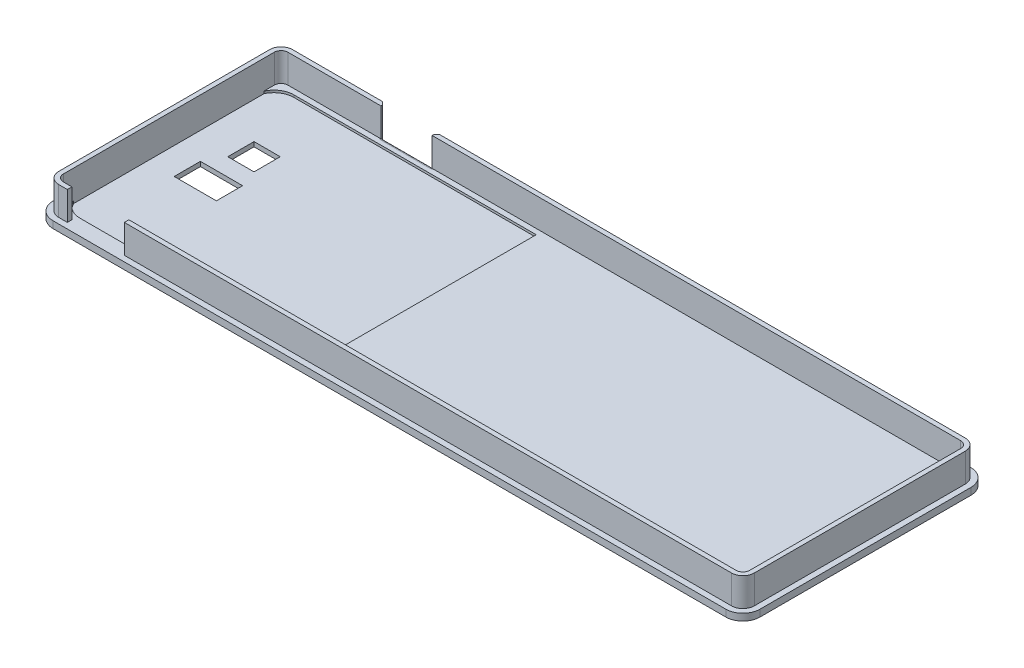
from build123d import *

# Parameters (mm, degrees)
SKETCH_1_W               = 124
SKETCH_1_H               = 43
EXTRUDE_1_DEPTH          = 1.2
CUT_EXTRUDE_1_REACH      = 110.402
SKETCH_3_W               = 7.4
SKETCH_3_H               = 4.6
SKETCH_3_W_2             = 4.6
CUT_EXTRUDE_2_DEPTH      = 0.4
FILLET_1_R               = 3
EXTRUDE_START            = 5
EXTRUDE_5_DEPTH          = 5
SKETCH_7_W               = 0.8
SKETCH_7_H               = 5.4
EXTRUDE_6_DEPTH          = 33.335489
SKETCH_8_W               = 4.5
SKETCH_8_H               = 0.8
CUT_EXTRUDE_3_DEPTH      = 5
CHAMFER_2_SIZE           = 0.5
CUT_EXTRUDE_5_DEPTH      = 109.510329697
CUT_EXTRUDE_5_DEPTH_BACK = 109.510329697
FILLET_2_R               = 3
FILLET_3_R               = 1
FILLET_4_R               = 0.5
SKETCH_10_W              = 10
SKETCH_10_H              = 0.8
CUT_EXTRUDE_6_DEPTH      = 5


with BuildPart() as part:
    # Эскиз1 → Бобышка-Вытянуть1 (new body)
    with BuildSketch(Plane(origin=(0, 0, 0), x_dir=(1, 0, 0), z_dir=(0, 1, 0))):
        with Locations((43.92682215, 1.5)):
            Rectangle(SKETCH_1_W, SKETCH_1_H)
    extrude(amount=EXTRUDE_1_DEPTH)

    # Эскиз3 → Вырез-Вытянуть1 (cut, up to next)
    with BuildSketch(Plane.XZ, mode=Mode.PRIVATE) as cut_extrude_1_sk1:
        with Locations((-7.87317785, -0.05)):
            Rectangle(SKETCH_3_W, SKETCH_3_H)
    cut_extrude_1_tool1 = extrude(cut_extrude_1_sk1.sketch, amount=-CUT_EXTRUDE_1_REACH, mode=Mode.PRIVATE) & part.part
    # Эскиз3 → Вырез-Вытянуть1 (cut, up to next)
    with BuildSketch(Plane.XZ, mode=Mode.PRIVATE) as cut_extrude_1_sk2:
        with Locations((-7.57317785, -7.75)):
            Rectangle(SKETCH_3_W_2, SKETCH_3_H)
    cut_extrude_1_tool2 = extrude(cut_extrude_1_sk2.sketch, amount=-CUT_EXTRUDE_1_REACH, mode=Mode.PRIVATE) & part.part
    add(cut_extrude_1_tool1.solids().sort_by_distance((-7.873178, 0, -0.05))[0], mode=Mode.SUBTRACT)
    add(cut_extrude_1_tool2.solids().sort_by_distance((-7.573178, 0, -7.75))[0], mode=Mode.SUBTRACT)

    # Эскиз4 → Вырез-Вытянуть2 (cut)
    with BuildSketch(Plane(origin=(0, 1.2, 0), x_dir=(1, 0, 0), z_dir=(0, 1, 0))):
        with BuildLine():
            Line((4.110011464, 20.25), (7.343632837, 20.25))
            Line((7.343632837, 20.25), (29.42682215, 20.25))
            Line((29.42682215, 20.25), (29.42682215, -13.75))
            ThreePointArc((29.42682215, -13.75), (28.401695885, -16.224873734), (25.92682215, -17.25))
            Line((25.92682215, -17.25), (-13.07317785, -17.25))
            ThreePointArc((-13.07317785, -17.25), (-15.548051584, -16.224873734), (-16.57317785, -13.75))
            Line((-16.57317785, -13.75), (-16.57317785, 16.75))
            ThreePointArc((-16.57317785, 16.75), (-15.548051584, 19.224873734), (-13.07317785, 20.25))
            Line((-13.07317785, 20.25), (4.110011464, 20.25))
        make_face()
    extrude(amount=-CUT_EXTRUDE_2_DEPTH, mode=Mode.SUBTRACT)

    # Скругление1
    fillet_1_edges = [part.edges().sort_by_distance(p)[0] for p in [
        (-18.07317785, 0.6, -23),
        (105.92682215, 0.6, -23),
        (105.92682215, 0.6, 20),
        (-18.07317785, 0.6, 20),
    ]]
    fillet(fillet_1_edges, radius=FILLET_1_R)

    # Эскиз5 → Бобышка-Вытянуть5 (add)
    with BuildSketch(Plane(origin=(0, 1.2, 0), x_dir=(1, 0, 0), z_dir=(0, 1, 0)).offset(EXTRUDE_START)):
        with BuildLine():
            ThreePointArc((102.92682215, -19), (104.341035713, -18.414213562), (104.92682215, -17))
            Line((104.92682215, -17), (104.92682215, 20))
            ThreePointArc((104.92682215, 20), (104.341035713, 21.414213562), (102.92682215, 22))
            Line((102.92682215, 22), (-15.07317785, 22))
            ThreePointArc((-15.07317785, 22), (-16.487391412, 21.414213562), (-17.07317785, 20))
            Line((-17.07317785, 20), (-17.07317785, -17))
            ThreePointArc((-17.07317785, -17), (-16.487391412, -18.414213562), (-15.07317785, -19))
            Line((-15.07317785, -19), (102.92682215, -19))
        make_face()
        with BuildLine():
            Line((102.92682215, -18.2), (-15.07317785, -18.2))
            ThreePointArc((-15.07317785, -18.2), (-15.921705987, -17.848528137), (-16.27317785, -17))
            Line((-16.27317785, -17), (-16.27317785, -15.167744688))
            ThreePointArc((-16.27317785, -15.167744688), (-16.497356583, -14.474568837), (-16.57317785, -13.75))
            Line((-16.57317785, -13.75), (-16.57317785, 16.75))
            ThreePointArc((-16.57317785, 16.75), (-16.497356583, 17.474568837), (-16.27317785, 18.167744688))
            Line((-16.27317785, 18.167744688), (-16.27317785, 20))
            ThreePointArc((-16.27317785, 20), (-15.921705987, 20.848528137), (-15.07317785, 21.2))
            Line((-15.07317785, 21.2), (102.92682215, 21.2))
            ThreePointArc((102.92682215, 21.2), (103.775350288, 20.848528137), (104.12682215, 20))
            Line((104.12682215, 20), (104.12682215, -17))
            ThreePointArc((104.12682215, -17), (103.775350288, -17.848528137), (102.92682215, -18.2))
        make_face(mode=Mode.SUBTRACT)
    extrude(amount=-EXTRUDE_5_DEPTH)

    # Эскиз7 → Бобышка-Вытянуть6 (add)
    with BuildSketch(Plane(origin=(0, 0, 15.167744688), x_dir=(-1, 0, 0), z_dir=(0, 0, -1))):
        with Locations((16.67317785, 3.5)):
            Rectangle(SKETCH_7_W, SKETCH_7_H)
    extrude(amount=EXTRUDE_6_DEPTH)

    # Эскиз8 → Вырез-Вытянуть3 (cut)
    with BuildSketch(Plane(origin=(0, 6.2, 0), x_dir=(1, 0, 0), z_dir=(0, 1, 0))):
        with Locations((7.97682215, 21.6)):
            Rectangle(SKETCH_8_W, SKETCH_8_H)
        with Locations((3.47682215, 21.6)):
            Rectangle(SKETCH_8_W, SKETCH_8_H)
    extrude(amount=-CUT_EXTRUDE_3_DEPTH, mode=Mode.SUBTRACT)

    # Фаска2
    chamfer_2_edges = [part.edges().sort_by_distance(p)[0] for p in [
        (1.22682215, 3.7, -22),
        (10.22682215, 3.7, -22),
    ]]
    chamfer(chamfer_2_edges, length=CHAMFER_2_SIZE)

    # Эскиз9 → Вырез-Вытянуть5 (cut, two sides: drawn at the far end of the back side and taken through both)
    with BuildSketch(Plane(origin=(0, 1.2, 0), x_dir=(1, 0, 0), z_dir=(0, 1, 0)).offset(-CUT_EXTRUDE_5_DEPTH_BACK)):
        Polygon((1.22682215, 21.5), (10.22682215, 21.5), (10.72682215, 22), (11.72682215, 23), (-0.27317785, 23), (0.72682215, 22), align=None)
    extrude(amount=CUT_EXTRUDE_5_DEPTH + CUT_EXTRUDE_5_DEPTH_BACK, mode=Mode.SUBTRACT)

    # Скругление2
    fillet_2_edges = [part.edges().sort_by_distance(p)[0] for p in [
        (-0.27317785, 0.6, -23),
        (11.72682215, 0.6, -23),
    ]]
    fillet(fillet_2_edges, radius=FILLET_2_R)

    # Скругление3
    fillet_3_edges = [part.edges().sort_by_distance(p)[0] for p in [
        (1.22682215, 0.6, -21.5),
        (10.22682215, 0.6, -21.5),
    ]]
    fillet(fillet_3_edges, radius=FILLET_3_R)

    # Скругление4
    # the kernel refuses this fillet: 0.5 mm, written as the material it takes off along each edge
    with BuildSketch(Plane(origin=(9.812608588, 1.2, -21.5), x_dir=(0, 0, 1), z_dir=(-1, 0, 0))) as fillet_4_piece_1:
        with BuildLine():
            CenterArc((FILLET_4_R, -FILLET_4_R), FILLET_4_R, 90, 90)
            Line((0, -FILLET_4_R), (0, 0))
            Line((0, 0), (FILLET_4_R, 0))
        make_face()
    extrude(amount=8.171572875, mode=Mode.SUBTRACT)
    with BuildSketch(Plane(origin=(1.641035713, 1.2, -22.5), x_dir=(-0.8939437975787546, 0, -0.448179078907611), z_dir=(0.448179078907611, 0, -0.8939437975787546))) as fillet_4_piece_2_section:
        with BuildLine():
            CenterArc((1 + FILLET_4_R, -FILLET_4_R), FILLET_4_R, 90, 90)
            Line((1, -FILLET_4_R), (1, 0))
            Line((1, 0), (1 + FILLET_4_R, 0))
        make_face()
    fillet_4_piece_2 = revolve(axis=Axis((1.641035713, 1.2, -22.5), (0, 1, 0)), revolution_arc=116.626915432, mode=Mode.PRIVATE)
    fillet_4_piece_2 = split(fillet_4_piece_2, bisect_by=Plane(origin=(1.130412309, 1.014643197, -21.596409841), z_dir=(0.7071067811865498, 0, -0.7071067811865454)), keep=Keep.TOP, mode=Mode.PRIVATE)
    add(fillet_4_piece_2, mode=Mode.SUBTRACT)
    with BuildSketch(Plane(origin=(1.641035713, 1.2, -22.5), x_dir=(-0.8939437975787546, 0, -0.448179078907611), z_dir=(0.448179078907611, 0, -0.8939437975787546))) as fillet_4_piece_3_section:
        with BuildLine():
            CenterArc((1 + FILLET_4_R, -FILLET_4_R), FILLET_4_R, 90, 90)
            Line((1, -FILLET_4_R), (1, 0))
            Line((1, 0), (1 + FILLET_4_R, 0))
        make_face()
    fillet_4_piece_3 = revolve(axis=Axis((1.641035713, 1.2, -22.5), (0, 1, 0)), revolution_arc=116.626915432, mode=Mode.PRIVATE)
    fillet_4_piece_3 = split(fillet_4_piece_3, bisect_by=Plane(origin=(1.22682215, 1.150324025, -21.336464166), z_dir=(1, 0, 0)), keep=Keep.TOP, mode=Mode.PRIVATE)
    add(fillet_4_piece_3, mode=Mode.SUBTRACT)
    with BuildSketch(Plane(origin=(1.641035713, 1.2, -22.5), x_dir=(-0.8939437975787546, 0, -0.448179078907611), z_dir=(0.448179078907611, 0, -0.8939437975787546))) as fillet_4_piece_4_section:
        with BuildLine():
            CenterArc((1 + FILLET_4_R, -FILLET_4_R), FILLET_4_R, 90, 90)
            Line((1, -FILLET_4_R), (1, 0))
            Line((1, 0), (1 + FILLET_4_R, 0))
        make_face()
    fillet_4_piece_4 = revolve(axis=Axis((1.641035713, 1.2, -22.5), (0, 1, 0)), revolution_arc=116.626915432, mode=Mode.PRIVATE)
    fillet_4_piece_4 = split(fillet_4_piece_4, bisect_by=Plane(origin=(1.152970199, 1.196161592, -21.2), z_dir=(0, 0, 1)), keep=Keep.TOP, mode=Mode.PRIVATE)
    add(fillet_4_piece_4, mode=Mode.SUBTRACT)
    with BuildSketch(Plane(origin=(9.812608588, 1.2, -22.5), x_dir=(0.8939437975787601, 0, -0.4481790789075999), z_dir=(-0.4481790789075999, 0, -0.8939437975787601))) as fillet_4_piece_5_section:
        with BuildLine():
            CenterArc((1 + FILLET_4_R, FILLET_4_R), FILLET_4_R, 180, 90)
            Line((1 + FILLET_4_R, 0), (1, 0))
            Line((1, 0), (1, FILLET_4_R))
        make_face()
    fillet_4_piece_5 = revolve(axis=Axis((9.812608588, 1.2, -22.5), (0, -1, 0)), revolution_arc=116.626915432, mode=Mode.PRIVATE)
    fillet_4_piece_5 = split(fillet_4_piece_5, bisect_by=Plane(origin=(10.323231991, 1.014642922, -21.59640984), z_dir=(-0.7071067811865426, 0, -0.7071067811865526)), keep=Keep.TOP, mode=Mode.PRIVATE)
    add(fillet_4_piece_5, mode=Mode.SUBTRACT)
    with BuildSketch(Plane(origin=(9.812608588, 1.2, -22.5), x_dir=(0.8939437975787601, 0, -0.4481790789075999), z_dir=(-0.4481790789075999, 0, -0.8939437975787601))) as fillet_4_piece_6_section:
        with BuildLine():
            CenterArc((1 + FILLET_4_R, FILLET_4_R), FILLET_4_R, 180, 90)
            Line((1 + FILLET_4_R, 0), (1, 0))
            Line((1, 0), (1, FILLET_4_R))
        make_face()
    fillet_4_piece_6 = revolve(axis=Axis((9.812608588, 1.2, -22.5), (0, -1, 0)), revolution_arc=116.626915432, mode=Mode.PRIVATE)
    fillet_4_piece_6 = split(fillet_4_piece_6, bisect_by=Plane(origin=(10.22682215, 1.150324024, -21.336464168), z_dir=(-1, 0, 0)), keep=Keep.TOP, mode=Mode.PRIVATE)
    add(fillet_4_piece_6, mode=Mode.SUBTRACT)
    with BuildSketch(Plane(origin=(9.812608588, 1.2, -22.5), x_dir=(0.8939437975787601, 0, -0.4481790789075999), z_dir=(-0.4481790789075999, 0, -0.8939437975787601))) as fillet_4_piece_7_section:
        with BuildLine():
            CenterArc((1 + FILLET_4_R, FILLET_4_R), FILLET_4_R, 180, 90)
            Line((1 + FILLET_4_R, 0), (1, 0))
            Line((1, 0), (1, FILLET_4_R))
        make_face()
    fillet_4_piece_7 = revolve(axis=Axis((9.812608588, 1.2, -22.5), (0, -1, 0)), revolution_arc=116.626915432, mode=Mode.PRIVATE)
    fillet_4_piece_7 = split(fillet_4_piece_7, bisect_by=Plane(origin=(10.300674101, 1.196161592, -21.2), z_dir=(0, 0, 1)), keep=Keep.TOP, mode=Mode.PRIVATE)
    add(fillet_4_piece_7, mode=Mode.SUBTRACT)

    # Эскиз10 → Вырез-Вытянуть6 (cut)
    with BuildSketch(Plane(origin=(0, 6.2, 0), x_dir=(1, 0, 0), z_dir=(0, 1, 0))):
        with Locations((-8.57317785, -18.6)):
            Rectangle(SKETCH_10_W, SKETCH_10_H)
    extrude(amount=-CUT_EXTRUDE_6_DEPTH, mode=Mode.SUBTRACT)


solid = part.part
